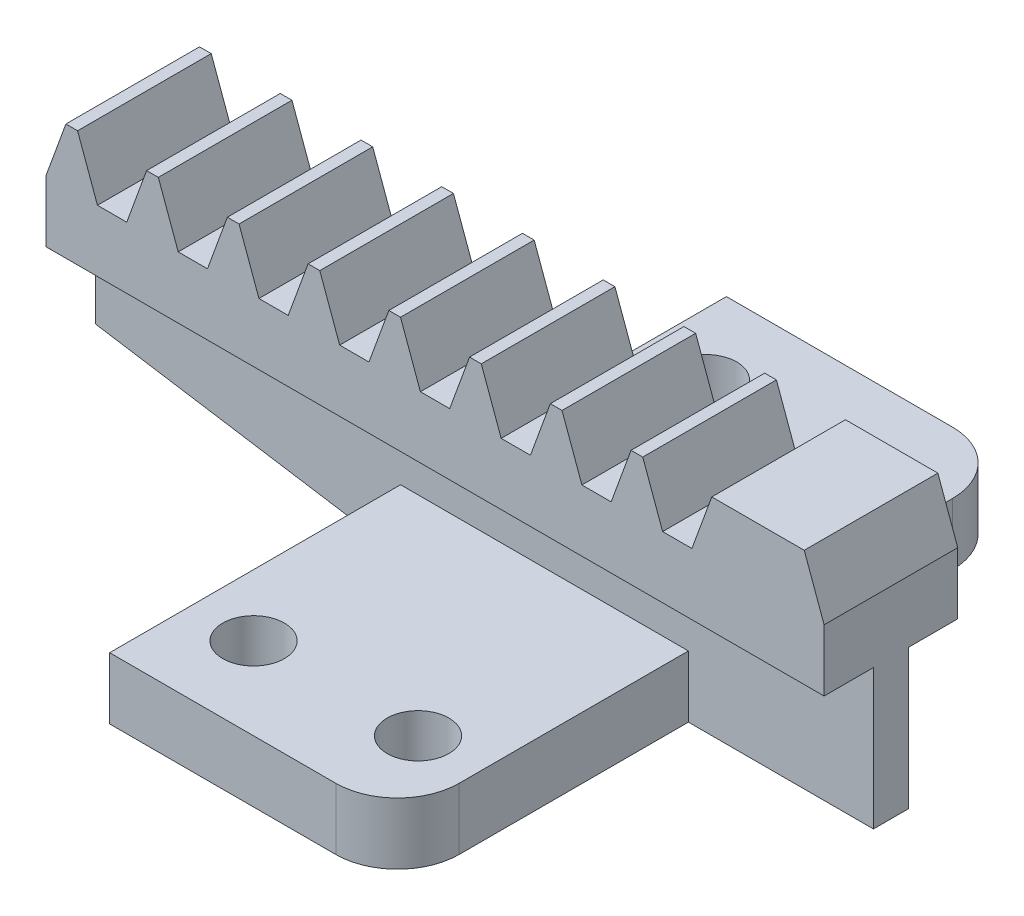
from build123d import *

# Parameters (mm, degrees)
ESQUISSE1_R             = 2.5
BOSS_EXTRU_1_DEPTH      = 1
BOSS_EXTRU_2_DEPTH      = 6.5
ESQUISSE3_R             = 14.137419556
ENL_V_MAT_EXTRU_1_DEPTH = 1
ESQUISSE4_W             = 37.844594902
ESQUISSE4_H             = 1.7
BOSS_EXTRU_3_DEPTH      = 3.8
BOSS_EXTRU_4_START      = -17.456
ESQUISSE5_W             = 20
ESQUISSE5_H             = 30
BOSS_EXTRU_4_DEPTH      = 3
BOSS_EXTRU_5_START      = -17.456
ESQUISSE7_W             = 3
ESQUISSE7_H             = 30
BOSS_EXTRU_5_DEPTH      = 3
CHANFREIN1_SIZE         = 3
CHANFREIN1_SIZE_2       = 18.941254544
ESQUISSE6_R             = 1.5
ENL_V_MAT_EXTRU_2_DEPTH = 47.131066324
BOSS_EXTRU_6_START      = 1
BOSS_EXTRU_6_DEPTH      = 6.5
ESQUISSE9_W             = 9
ESQUISSE9_H             = 14.15
ENL_V_MAT_EXTRU_3_DEPTH = 43.415130321
CONG_2_R                = 3


with BuildPart() as part:
    # Esquisse1 → Boss.-Extru.1 (new body)
    with BuildSketch(Plane.XY):
        with BuildLine():
            ThreePointArc((-2.797532396, 7.349311298), (-3.009326841, 7.265157674), (-3.218593728, 7.174901984))
            ThreePointArc((-3.218593728, 7.174901984), (-3.518823735, 7.161602241), (-3.746621491, 7.357620412))
            ThreePointArc((-3.746621491, 7.357620412), (-4.480939546, 8.300763177), (-5.498824516, 8.927382256))
            ThreePointArc((-5.498824516, 8.927382256), (-5.825153893, 8.717958885), (-6.143516706, 8.496612707))
            ThreePointArc((-6.143516706, 8.496612707), (-5.954123878, 7.316412877), (-5.363784935, 6.277066345))
            ThreePointArc((-5.363784935, 6.277066345), (-5.269862186, 5.991595754), (-5.397042596, 5.719308987))
            ThreePointArc((-5.397042596, 5.719308987), (-5.560510951, 5.560510951), (-5.719308987, 5.397042596))
            ThreePointArc((-5.719308987, 5.397042596), (-5.991595754, 5.269862186), (-6.277066345, 5.363784935))
            ThreePointArc((-6.277066345, 5.363784935), (-7.316412877, 5.954123878), (-8.496612707, 6.143516706))
            ThreePointArc((-8.496612707, 6.143516706), (-8.717958885, 5.825153893), (-8.927382256, 5.498824516))
            ThreePointArc((-8.927382256, 5.498824516), (-8.300763177, 4.480939546), (-7.357620412, 3.746621491))
            ThreePointArc((-7.357620412, 3.746621491), (-7.161602241, 3.518823735), (-7.174901984, 3.218593728))
            ThreePointArc((-7.174901984, 3.218593728), (-7.265157674, 3.009326841), (-7.349311298, 2.797532396))
            ThreePointArc((-7.349311298, 2.797532396), (-7.552201634, 2.575833384), (-7.851884749, 2.553361824))
            ThreePointArc((-7.851884749, 2.553361824), (-9.038028671, 2.701023192), (-10.200868635, 2.424356428))
            ThreePointArc((-10.200868635, 2.424356428), (-10.283533665, 2.045522026), (-10.352134785, 1.663890139))
            ThreePointArc((-10.352134785, 1.663890139), (-9.383686529, 0.963283789), (-8.231324879, 0.645787478))
            ThreePointArc((-8.231324879, 0.645787478), (-7.963053276, 0.510342701), (-7.860447586, 0.22787675))
            ThreePointArc((-7.860447586, 0.22787675), (-7.86375, 0), (-7.860447586, -0.22787675))
            ThreePointArc((-7.860447586, -0.22787675), (-7.963053276, -0.510342701), (-8.231324879, -0.645787478))
            ThreePointArc((-8.231324879, -0.645787478), (-9.383686529, -0.963283789), (-10.352134785, -1.663890139))
            ThreePointArc((-10.352134785, -1.663890139), (-10.283533665, -2.045522026), (-10.200868635, -2.424356428))
            ThreePointArc((-10.200868635, -2.424356428), (-9.038028671, -2.701023192), (-7.851884749, -2.553361824))
            ThreePointArc((-7.851884749, -2.553361824), (-7.552201634, -2.575833384), (-7.349311298, -2.797532396))
            ThreePointArc((-7.349311298, -2.797532396), (-7.265157674, -3.009326841), (-7.174901984, -3.218593728))
            ThreePointArc((-7.174901984, -3.218593728), (-7.161602241, -3.518823735), (-7.357620412, -3.746621491))
            ThreePointArc((-7.357620412, -3.746621491), (-8.300763177, -4.480939546), (-8.927382256, -5.498824516))
            ThreePointArc((-8.927382256, -5.498824516), (-8.717958885, -5.825153893), (-8.496612707, -6.143516706))
            ThreePointArc((-8.496612707, -6.143516706), (-7.316412877, -5.954123878), (-6.277066345, -5.363784935))
            ThreePointArc((-6.277066345, -5.363784935), (-5.991595754, -5.269862186), (-5.719308987, -5.397042596))
            ThreePointArc((-5.719308987, -5.397042596), (-5.560510951, -5.560510951), (-5.397042596, -5.719308987))
            ThreePointArc((-5.397042596, -5.719308987), (-5.269862186, -5.991595754), (-5.363784935, -6.277066345))
            ThreePointArc((-5.363784935, -6.277066345), (-5.954123878, -7.316412877), (-6.143516706, -8.496612707))
            ThreePointArc((-6.143516706, -8.496612707), (-5.825153893, -8.717958885), (-5.498824516, -8.927382256))
            ThreePointArc((-5.498824516, -8.927382256), (-4.480939546, -8.300763177), (-3.746621491, -7.357620412))
            ThreePointArc((-3.746621491, -7.357620412), (-3.518823735, -7.161602241), (-3.218593728, -7.174901984))
            ThreePointArc((-3.218593728, -7.174901984), (-3.009326841, -7.265157674), (-2.797532396, -7.349311298))
            ThreePointArc((-2.797532396, -7.349311298), (-2.575833384, -7.552201634), (-2.553361824, -7.851884749))
            ThreePointArc((-2.553361824, -7.851884749), (-2.701023192, -9.038028671), (-2.424356428, -10.200868635))
            ThreePointArc((-2.424356428, -10.200868635), (-2.045522026, -10.283533665), (-1.663890139, -10.352134785))
            ThreePointArc((-1.663890139, -10.352134785), (-0.963283789, -9.383686529), (-0.645787478, -8.231324879))
            ThreePointArc((-0.645787478, -8.231324879), (-0.510342701, -7.963053276), (-0.22787675, -7.860447586))
            ThreePointArc((-0.22787675, -7.860447586), (0, -7.86375), (0.22787675, -7.860447586))
            ThreePointArc((0.22787675, -7.860447586), (0.510342701, -7.963053276), (0.645787478, -8.231324879))
            ThreePointArc((0.645787478, -8.231324879), (0.963283789, -9.383686529), (1.663890139, -10.352134785))
            ThreePointArc((1.663890139, -10.352134785), (2.045522026, -10.283533665), (2.424356428, -10.200868635))
            ThreePointArc((2.424356428, -10.200868635), (2.701023192, -9.038028671), (2.553361824, -7.851884749))
            ThreePointArc((2.553361824, -7.851884749), (2.575833384, -7.552201634), (2.797532396, -7.349311298))
            ThreePointArc((2.797532396, -7.349311298), (3.009326841, -7.265157674), (3.218593728, -7.174901984))
            ThreePointArc((3.218593728, -7.174901984), (3.518823735, -7.161602241), (3.746621491, -7.357620412))
            ThreePointArc((3.746621491, -7.357620412), (4.480939546, -8.300763177), (5.498824516, -8.927382256))
            ThreePointArc((5.498824516, -8.927382256), (5.825153893, -8.717958885), (6.143516706, -8.496612707))
            ThreePointArc((6.143516706, -8.496612707), (5.954123878, -7.316412877), (5.363784935, -6.277066345))
            ThreePointArc((5.363784935, -6.277066345), (5.269862186, -5.991595754), (5.397042596, -5.719308987))
            ThreePointArc((5.397042596, -5.719308987), (5.560510951, -5.560510951), (5.719308987, -5.397042596))
            ThreePointArc((5.719308987, -5.397042596), (5.991595754, -5.269862186), (6.277066345, -5.363784935))
            ThreePointArc((6.277066345, -5.363784935), (7.316412877, -5.954123878), (8.496612707, -6.143516706))
            ThreePointArc((8.496612707, -6.143516706), (8.717958885, -5.825153893), (8.927382256, -5.498824516))
            ThreePointArc((8.927382256, -5.498824516), (8.300763177, -4.480939546), (7.357620412, -3.746621491))
            ThreePointArc((7.357620412, -3.746621491), (7.161602241, -3.518823735), (7.174901984, -3.218593728))
            ThreePointArc((7.174901984, -3.218593728), (7.265157674, -3.009326841), (7.349311298, -2.797532396))
            ThreePointArc((7.349311298, -2.797532396), (7.552201634, -2.575833384), (7.851884749, -2.553361824))
            ThreePointArc((7.851884749, -2.553361824), (9.038028671, -2.701023192), (10.200868635, -2.424356428))
            ThreePointArc((10.200868635, -2.424356428), (10.283533665, -2.045522026), (10.352134785, -1.663890139))
            ThreePointArc((10.352134785, -1.663890139), (9.383686529, -0.963283789), (8.231324879, -0.645787478))
            ThreePointArc((8.231324879, -0.645787478), (7.963053276, -0.510342701), (7.860447586, -0.22787675))
            ThreePointArc((7.860447586, -0.22787675), (7.86375, 0), (7.860447586, 0.22787675))
            ThreePointArc((7.860447586, 0.22787675), (7.963053276, 0.510342701), (8.231324879, 0.645787478))
            ThreePointArc((8.231324879, 0.645787478), (9.383686529, 0.963283789), (10.352134785, 1.663890139))
            ThreePointArc((10.352134785, 1.663890139), (10.283533665, 2.045522026), (10.200868635, 2.424356428))
            ThreePointArc((10.200868635, 2.424356428), (9.038028671, 2.701023192), (7.851884749, 2.553361824))
            ThreePointArc((7.851884749, 2.553361824), (7.552201634, 2.575833384), (7.349311298, 2.797532396))
            ThreePointArc((7.349311298, 2.797532396), (7.265157674, 3.009326841), (7.174901984, 3.218593728))
            ThreePointArc((7.174901984, 3.218593728), (7.161602241, 3.518823735), (7.357620412, 3.746621491))
            ThreePointArc((7.357620412, 3.746621491), (8.300763177, 4.480939546), (8.927382256, 5.498824516))
            ThreePointArc((8.927382256, 5.498824516), (8.717958885, 5.825153893), (8.496612707, 6.143516706))
            ThreePointArc((8.496612707, 6.143516706), (7.316412877, 5.954123878), (6.277066345, 5.363784935))
            ThreePointArc((6.277066345, 5.363784935), (5.991595754, 5.269862186), (5.719308987, 5.397042596))
            ThreePointArc((5.719308987, 5.397042596), (5.560510951, 5.560510951), (5.397042596, 5.719308987))
            ThreePointArc((5.397042596, 5.719308987), (5.269862186, 5.991595754), (5.363784935, 6.277066345))
            ThreePointArc((5.363784935, 6.277066345), (5.954123878, 7.316412877), (6.143516706, 8.496612707))
            ThreePointArc((6.143516706, 8.496612707), (5.825153893, 8.717958885), (5.498824516, 8.927382256))
            ThreePointArc((5.498824516, 8.927382256), (4.480939546, 8.300763177), (3.746621491, 7.357620412))
            ThreePointArc((3.746621491, 7.357620412), (3.518823735, 7.161602241), (3.218593728, 7.174901984))
            ThreePointArc((3.218593728, 7.174901984), (3.009326841, 7.265157674), (2.797532396, 7.349311298))
            ThreePointArc((2.797532396, 7.349311298), (2.575833384, 7.552201634), (2.553361824, 7.851884749))
            ThreePointArc((2.553361824, 7.851884749), (2.701023192, 9.038028671), (2.424356428, 10.200868635))
            ThreePointArc((2.424356428, 10.200868635), (2.045522026, 10.283533665), (1.663890139, 10.352134785))
            ThreePointArc((1.663890139, 10.352134785), (0.963283789, 9.383686529), (0.645787478, 8.231324879))
            ThreePointArc((0.645787478, 8.231324879), (0.510342701, 7.963053276), (0.22787675, 7.860447586))
            ThreePointArc((0.22787675, 7.860447586), (0, 7.86375), (-0.22787675, 7.860447586))
            ThreePointArc((-0.22787675, 7.860447586), (-0.510342701, 7.963053276), (-0.645787478, 8.231324879))
            ThreePointArc((-0.645787478, 8.231324879), (-0.963283789, 9.383686529), (-1.663890139, 10.352134785))
            ThreePointArc((-1.663890139, 10.352134785), (-2.045522026, 10.283533665), (-2.424356428, 10.200868635))
            ThreePointArc((-2.424356428, 10.200868635), (-2.701023192, 9.038028671), (-2.553361824, 7.851884749))
            ThreePointArc((-2.553361824, 7.851884749), (-2.575833384, 7.552201634), (-2.797532396, 7.349311298))
        make_face()
        Circle(ESQUISSE1_R, mode=Mode.SUBTRACT)
    extrude(amount=BOSS_EXTRU_1_DEPTH)

    # Esquisse2 → Boss.-Extru.2 (add)
    with BuildSketch(Plane.XY.offset(1)):
        Polygon((0.284655009, -8), (1.251359951, -10.656), (2.675515049, -10.656), (3.642219991, -8), (4.211530009, -8), (5.178234951, -10.656), (6.602390049, -10.656), (7.569094991, -8), (8.138405009, -8), (9.105109951, -10.656), (10.529265049, -10.656), (11.495969991, -8), (12.065280009, -8), (13.031984951, -10.656), (14.456140049, -10.656), (15.422844991, -8), (15.992155009, -8), (16.958859951, -10.656), (18.383015049, -10.656), (19.349719991, -8), (19.919030009, -8), (20.885734951, -10.656), (22.309890049, -10.656), (23.276594991, -8), (23.845905009, -8), (24.812609951, -10.656), (26.236765049, -10.656), (27.203469991, -8), (27.772780009, -8), (28.739484951, -10.656), (30.163640049, -10.656), (31.130344991, -8), (31.699655009, -8), (32.666359951, -10.656), (34.090515049, -10.656), (35.057219991, -8), (35.626530009, -8), (36.593234951, -10.656), (36.593234951, -13.656), (-1.251359951, -13.656), (-1.251359951, -10.656), (-0.284655009, -8), align=None)
    extrude(amount=BOSS_EXTRU_2_DEPTH)

    # Esquisse3 → Enlèv. mat.-Extru.1 (cut)
    with BuildSketch(Plane(origin=(0, 0, 0), x_dir=(-1, 0, 0), z_dir=(0, 0, -1))):
        Circle(ESQUISSE3_R)
    extrude(amount=-ENL_V_MAT_EXTRU_1_DEPTH, mode=Mode.SUBTRACT)

    # Esquisse4 → Boss.-Extru.3 (add)
    with BuildSketch(Plane.XZ.offset(13.656)):
        with Locations((17.6709375, 4.25)):
            Rectangle(ESQUISSE4_W, ESQUISSE4_H)
    extrude(amount=BOSS_EXTRU_3_DEPTH)

    # Esquisse5 → Boss.-Extru.4 (add)
    with BuildSketch(Plane(origin=(0, 0, 0), x_dir=(1, 0, 0), z_dir=(0, 1, 0)).offset(BOSS_EXTRU_4_START)):
        with Locations((26.593234951, -4.25)):
            Rectangle(ESQUISSE5_W, ESQUISSE5_H)
    extrude(amount=-BOSS_EXTRU_4_DEPTH)

    # Esquisse7 → Boss.-Extru.5 (add)
    with BuildSketch(Plane(origin=(0, 0, 0), x_dir=(1, 0, 0), z_dir=(0, 1, 0)).offset(BOSS_EXTRU_5_START)):
        with Locations((15.093234951, -4.25)):
            Rectangle(ESQUISSE7_W, ESQUISSE7_H)
    extrude(amount=-BOSS_EXTRU_5_DEPTH)

    # Chanfrein1
    # the kernel refuses this chamfer: 18.941254544, 3 mm, written as the material it adds along each edge
    with BuildSketch(Plane(origin=(13.593234951, -17.456, 3.4), x_dir=(0.23333663699196244, -0.9723960169793381, 0), z_dir=(0, 0, 1))) as chanfrein1_piece_1_section:
        Polygon((CHANFREIN1_SIZE * 0.972396016979, -CHANFREIN1_SIZE * 0.233336636992), (-CHANFREIN1_SIZE_2 * 0.233336636992, -CHANFREIN1_SIZE_2 * 0.972396016981), (0, 0), align=None)
    chanfrein1_piece_1 = extrude(amount=1.7, mode=Mode.PRIVATE)
    chanfrein1_piece_1 = split(chanfrein1_piece_1, bisect_by=Plane(origin=(-1.251359951, -18.494459875, 4.25), z_dir=(1, 0, 0)), keep=Keep.TOP, mode=Mode.PRIVATE)
    add(chanfrein1_piece_1)

    # Esquisse6 → Enlèv. mat.-Extru.2 (cut, through all)
    with BuildSketch(Plane(origin=(0, 0, 0), x_dir=(1, 0, 0), z_dir=(0, 1, 0))):
        with Locations(Location((16.593234951, 6.75, 0), (0, 0, 270))):
            Circle(ESQUISSE6_R)
        with Locations(Location((24.593234951, 6.75, 0), (0, 0, 270))):
            Circle(ESQUISSE6_R)
        with Locations(Location((24.593234951, -15.25, 0), (0, 0, 270))):
            Circle(ESQUISSE6_R)
        with Locations(Location((16.593234951, -15.25, 0), (0, 0, 270))):
            Circle(ESQUISSE6_R)
    extrude(amount=-ENL_V_MAT_EXTRU_2_DEPTH, mode=Mode.SUBTRACT)

    # Esquisse8 → Boss.-Extru.6 (add)
    with BuildSketch(Plane.XY.offset(BOSS_EXTRU_6_START)):
        Polygon((31.699655009, -8), (35.057219991, -8), (34.090515049, -10.656), (32.666359951, -10.656), align=None)
    extrude(amount=BOSS_EXTRU_6_DEPTH)

    # Esquisse9 → Enlèv. mat.-Extru.3 (cut, through all)
    with BuildSketch(Plane(origin=(0, -17.456, 0), x_dir=(1, 0, 0), z_dir=(0, 1, 0))):
        with Locations((32.093234951, 3.675)):
            Rectangle(ESQUISSE9_W, ESQUISSE9_H)
        with Locations((32.093234951, -12.175)):
            Rectangle(ESQUISSE9_W, ESQUISSE9_H)
    extrude(amount=-ENL_V_MAT_EXTRU_3_DEPTH, mode=Mode.SUBTRACT)

    # Congé2
    cong_2_edges = [part.edges().sort_by_distance(p)[0] for p in [
        (27.593234951, -18.956, -10.75),
        (27.593234951, -18.956, 19.25),
    ]]
    fillet(cong_2_edges, radius=CONG_2_R)


solid = part.part
